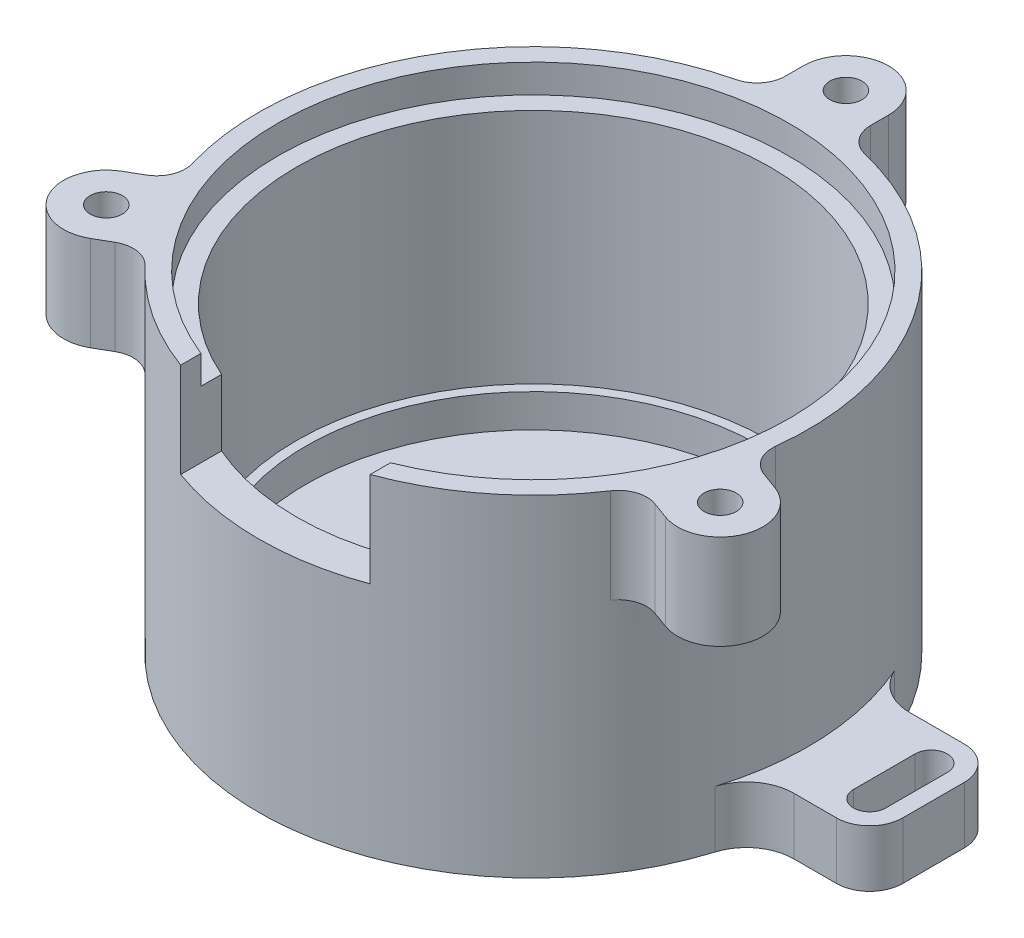
from build123d import *

# Parameters (mm, degrees)
ESQUISSE1_R                        = 2.4
BOSS_EXTRU_1_DEPTH                 = 10
ESQUISSE1_3_R                      = 2.4
BOSS_EXTRU_2_DEPTH                 = 4
CHANFREIN2_SIZE                    = 0.5
CONG_1_R                           = 3
R_P_TITION_START                   = 27.5
R_P_TITION_CIRCULAIRE1_OUTLINE_R   = 2.4
R_P_TITION_CIRCULAIRE1_DEPTH       = 4
R_P_TITION_START_2                 = 21.5
R_P_TITION_CIRCULAIRE1_2_OUTLINE_R = 2.4
R_P_TITION_CIRCULAIRE1_2_DEPTH     = 10
M3_CLEARANCE_HOLE1_D               = 3.4
ENL_V_MAT_EXTRU_2_DEPTH            = 10
BOSS_EXTRU_3_START                 = -6
BOSS_EXTRU_3_DEPTH                 = 6
CONG_3_R                           = 5


with BuildPart() as part:
    # Sketch1 → Revolve1 (revolve)
    with BuildSketch(Plane.XY, mode=Mode.PRIVATE) as revolve1_sk:
        Polygon((29, -3.5), (29, 31.5), (27, 31.5), (27, 28.5), (25, 28.5), (25, 3.5), (24, 3.5), (24, 0), (9, 0), (8, -1), (8, -6), (6.5, -6), (6.5, -7.5), (10, -7.5), (10, -3.5), align=None)
    revolve(revolve1_sk.sketch.rotate(Axis((0, 34.575175177, 0), (0, -1, 0)), 90), axis=Axis((0, 34.575175177, 0), (0, -1, 0)))

    # Esquisse1 → Boss.-Extru.1 (add)
    with BuildSketch(Plane(origin=(0, 31.5, 0), x_dir=(1, 0, 0), z_dir=(0, 1, 0))):
        with BuildLine():
            Line((4.5, 28.648734702), (4.5, 33))
            ThreePointArc((4.5, 33), (0, 37.5), (-4.5, 33))
            Line((-4.5, 33), (-4.5, 28.648734702))
            ThreePointArc((-4.5, 28.648734702), (0, 29), (4.5, 28.648734702))
        make_face()
        with Locations(Location((0, 33, 0), (0, 0, 270))):
            Circle(ESQUISSE1_R, mode=Mode.SUBTRACT)
    extrude(amount=-BOSS_EXTRU_1_DEPTH)

    # Esquisse1<3> → Boss.-Extru.2 (add)
    with BuildSketch(Plane(origin=(0, 31.5, 0), x_dir=(1, 0, 0), z_dir=(0, 1, 0))):
        with Locations(Location((0, 33, 0), (0, 0, 270))):
            Circle(ESQUISSE1_3_R)
    extrude(amount=-BOSS_EXTRU_2_DEPTH)

    # Chanfrein2
    chanfrein2_edges = [part.edges().sort_by_distance(p)[0] for p in [
        (0, 21.5, -35.4),
    ]]
    chamfer(chanfrein2_edges, length=CHANFREIN2_SIZE)

    # Congé1
    cong_1_edges = [part.edges().sort_by_distance(p)[0] for p in [
        (4.5, 26.5, -28.648734702),
        (-4.5, 26.5, -28.648734702),
    ]]
    fillet(cong_1_edges, radius=CONG_1_R)



with BuildPart() as body_2:
    # Répétition circulaire1: read off the stored shape, not the designer's step
    # Répétition circulaire1 outline → Répétition circulaire1 (new body)
    with BuildSketch(Plane(origin=(0, 0, 0), x_dir=(1, 0, 0), z_dir=(0, 1, 0)).offset(R_P_TITION_START)):
        with Locations((31.009856486, -11.28666473)):
            Circle(R_P_TITION_CIRCULAIRE1_OUTLINE_R)
        with Locations((-28.578838325, -16.5)):
            Circle(R_P_TITION_CIRCULAIRE1_OUTLINE_R)
    extrude(amount=R_P_TITION_CIRCULAIRE1_DEPTH)


with BuildPart() as part_1:
    add(part.part)

    add(body_2.part)  # R_p_tition circulaire1 2 merges body 2
    # R_p_tition circulaire1 2 outline → R_p_tition circulaire1 2 (add)
    # profile 1 of 2: a face of its own
    with BuildSketch(Plane(origin=(0, 0, 0), x_dir=(1, 0, 0), z_dir=(0, 1, 0)).offset(R_P_TITION_START_2)):
        with BuildLine():
            Line((-29.190907557, -11.657225913), (-30.828838325, -12.602885683))
            ThreePointArc((-30.828838325, -12.602885683), (-32.475952642, -18.75), (-26.328838325, -20.397114317))
            Line((-26.328838325, -20.397114317), (-24.690907557, -19.451454547))
            ThreePointArc((-24.690907557, -19.451454547), (-22.761849141, -19.080371134), (-21.016759974, -19.98238725))
            ThreePointArc((-21.016759974, -19.98238725), (-25.11473671, -14.5), (-27.813634974, -8.209854417))
            ThreePointArc((-27.813634974, -8.209854417), (-27.905010686, -10.172154026), (-29.190907557, -11.657225913))
        make_face()
        with Locations((-28.578838325, -16.5)):
            Circle(R_P_TITION_CIRCULAIRE1_2_OUTLINE_R, mode=Mode.SUBTRACT)
    # profile 2 of 2: a face of its own
    with BuildSketch(Plane(origin=(0, 0, 0), x_dir=(1, 0, 0), z_dir=(0, 1, 0)).offset(R_P_TITION_START_2)):
        with BuildLine():
            ThreePointArc((30.771688116, -6.411178556), (29.247446881, -5.171961896), (28.81670962, -3.255341254))
            ThreePointArc((28.81670962, -3.255341254), (27.251086003, -9.918584157), (24.167373297, -16.029287818))
            ThreePointArc((24.167373297, -16.029287818), (25.729317183, -14.8379438), (27.693506826, -14.868412143))
            Line((27.693506826, -14.868412143), (29.470765841, -15.515281523))
            ThreePointArc((29.470765841, -15.515281523), (35.238473279, -12.825755374), (32.548947131, -7.058047936))
            Line((32.548947131, -7.058047936), (30.771688116, -6.411178556))
        make_face()
        with Locations((31.009856486, -11.28666473)):
            Circle(R_P_TITION_CIRCULAIRE1_2_OUTLINE_R, mode=Mode.SUBTRACT)
    extrude(amount=R_P_TITION_CIRCULAIRE1_2_DEPTH)

    # R_p_tition circulaire1 3: loft between two sections, ruled curve by curve
    r_p_tition_circulaire1_3_from = [
        Edge.make_three_point_arc((-28.578838325, 22, 18.9), (-30.978838325, 22, 16.5), (-28.578838325, 22, 14.1)),
        Edge.make_three_point_arc((-28.578838325, 22, 14.1), (-26.178838325, 22, 16.5), (-28.578838325, 22, 18.9)),
    ]
    r_p_tition_circulaire1_3_to = [
        Edge.make_three_point_arc((-28.578838325, 21.5, 19.4), (-31.478838325, 21.5, 16.5), (-28.578838325, 21.5, 13.6)),
        Edge.make_three_point_arc((-28.578838325, 21.5, 13.6), (-25.678838325, 21.5, 16.5), (-28.578838325, 21.5, 19.4)),
    ]
    r_p_tition_circulaire1_3 = Solid(Shell([*[Face.make_surface_from_curves(r_p_tition_circulaire1_3_from[k], r_p_tition_circulaire1_3_to[k]) for k in range(2)], Face(Wire(r_p_tition_circulaire1_3_from)), Face(Wire(r_p_tition_circulaire1_3_to))]))
    add(r_p_tition_circulaire1_3, mode=Mode.SUBTRACT)

    # R_p_tition circulaire1 4: loft between two sections, ruled curve by curve
    r_p_tition_circulaire1_4_from = [
        Edge.make_three_point_arc((31.009856486, 22, 13.68666473), (28.609856486, 22, 11.28666473), (31.009856486, 22, 8.88666473)),
        Edge.make_three_point_arc((31.009856486, 22, 8.88666473), (33.409856486, 22, 11.28666473), (31.009856486, 22, 13.68666473)),
    ]
    r_p_tition_circulaire1_4_to = [
        Edge.make_three_point_arc((31.009856486, 21.5, 14.18666473), (28.109856486, 21.5, 11.28666473), (31.009856486, 21.5, 8.38666473)),
        Edge.make_three_point_arc((31.009856486, 21.5, 8.38666473), (33.909856486, 21.5, 11.28666473), (31.009856486, 21.5, 14.18666473)),
    ]
    r_p_tition_circulaire1_4 = Solid(Shell([*[Face.make_surface_from_curves(r_p_tition_circulaire1_4_from[k], r_p_tition_circulaire1_4_to[k]) for k in range(2)], Face(Wire(r_p_tition_circulaire1_4_from)), Face(Wire(r_p_tition_circulaire1_4_to))]))
    add(r_p_tition_circulaire1_4, mode=Mode.SUBTRACT)

    # M3 Clearance Hole1 (through all)
    with Locations(Plane(origin=(0, 31.5, 0), x_dir=(1, 0, 0), z_dir=(0, 1, 0))):
        with Locations((0, 33), (-28.578838325, -16.5), (31.009856486, -11.28666473)):
            Hole(M3_CLEARANCE_HOLE1_D / 2)

    # Esquisse5 → Enlèv. mat.-Extru.2 (cut)
    with BuildSketch(Plane(origin=(0, 31.5, 0), x_dir=(1, 0, 0), z_dir=(0, 1, 0))):
        with BuildLine():
            Line((-10, -22.912878475), (-10, -27.221315178))
            ThreePointArc((-10, -27.221315178), (0, -29), (10, -27.221315178))
            Line((10, -27.221315178), (10, -22.912878475))
            ThreePointArc((10, -22.912878475), (0, -25), (-10, -22.912878475))
        make_face()
    extrude(amount=-ENL_V_MAT_EXTRU_2_DEPTH, mode=Mode.SUBTRACT)

    # Esquisse6 → Boss.-Extru.3 (add)
    # profile 1 of 4: a face of its own
    with BuildSketch(Plane.XZ.offset(3.5).offset(BOSS_EXTRU_3_START)):
        with BuildLine():
            Line((37, 5), (28.565713714, 5))
            ThreePointArc((28.565713714, 5), (28.891224426, 2.50941251), (29, 0))
            ThreePointArc((29, 0), (28.679817788, -4.297447108), (27.726341266, -8.5))
            Line((27.726341266, -8.5), (37, -8.5))
            ThreePointArc((37, -8.5), (34.525126266, -7.474873734), (33.5, -5))
            Line((33.5, -5), (33.5, 1.5))
            ThreePointArc((33.5, 1.5), (34.525126266, 3.974873734), (37, 5))
        make_face()
    # profile 2 of 4: a face of its own
    with BuildSketch(Plane.XZ.offset(3.5).offset(BOSS_EXTRU_3_START)):
        with BuildLine():
            ThreePointArc((33.5, -5), (37, -8.5), (40.5, -5))
            Line((40.5, -5), (40.5, 1.5))
            ThreePointArc((40.5, 1.5), (37, 5), (33.5, 1.5))
            Line((33.5, 1.5), (33.5, -5))
        make_face()
        with BuildLine():
            ThreePointArc((38.7, 1.5), (37, 3.2), (35.3, 1.5))
            Line((35.3, 1.5), (35.3, -5))
            ThreePointArc((35.3, -5), (37, -6.7), (38.7, -5))
            Line((38.7, -5), (38.7, 1.5))
        make_face(mode=Mode.SUBTRACT)
    # profile 3 of 4: a face of its own
    with BuildSketch(Plane.XZ.offset(3.5).offset(BOSS_EXTRU_3_START)):
        with BuildLine():
            ThreePointArc((-33, 5), (-30.525126266, 3.974873734), (-29.5, 1.5))
            Line((-29.5, 1.5), (-29.5, -5))
            ThreePointArc((-29.5, -5), (-30.525126266, -7.474873734), (-33, -8.5))
            Line((-33, -8.5), (-27.726341266, -8.5))
            ThreePointArc((-27.726341266, -8.5), (-28.944107578, -1.799621218), (-28.565713714, 5))
            Line((-28.565713714, 5), (-33, 5))
        make_face()
    # profile 4 of 4: a face of its own
    with BuildSketch(Plane.XZ.offset(3.5).offset(BOSS_EXTRU_3_START)):
        with BuildLine():
            ThreePointArc((-36.5, -5), (-33, -8.5), (-29.5, -5))
            Line((-29.5, -5), (-29.5, 1.5))
            ThreePointArc((-29.5, 1.5), (-33, 5), (-36.5, 1.5))
            Line((-36.5, 1.5), (-36.5, -5))
        make_face()
        with BuildLine():
            ThreePointArc((-31.3, 1.5), (-33, 3.2), (-34.7, 1.5))
            Line((-34.7, 1.5), (-34.7, -5))
            ThreePointArc((-34.7, -5), (-33, -6.7), (-31.3, -5))
            Line((-31.3, -5), (-31.3, 1.5))
        make_face(mode=Mode.SUBTRACT)
    extrude(amount=BOSS_EXTRU_3_DEPTH)

    # Congé3
    cong_3_edges = [part_1.edges().sort_by_distance(p)[0] for p in [
        (27.726341266, -0.5, -8.5),
        (28.565713714, -0.5, 5),
        (-28.565713714, -0.5, 5),
        (-27.726341266, -0.5, -8.5),
    ]]
    fillet(cong_3_edges, radius=CONG_3_R)


solid = part_1.part
